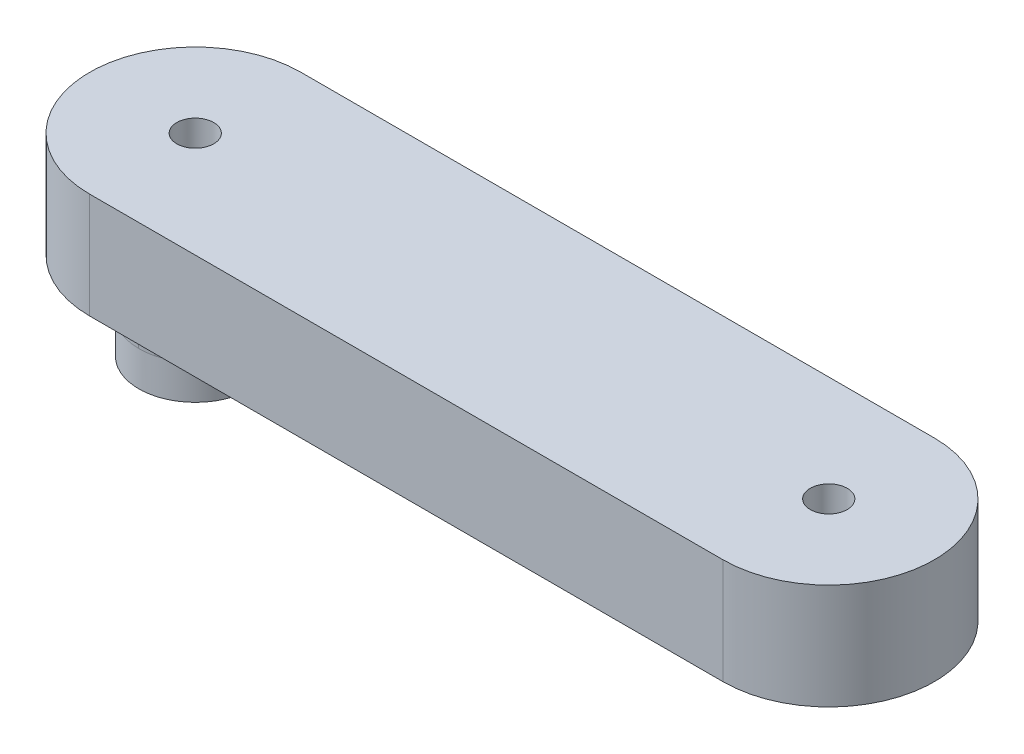
from build123d import *

# Parameters (mm, degrees)
BOSS_EXTRUDE1_DEPTH = 10
CUT_EXTRUDE1_REACH  = 44.426
SKETCH2_R           = 1.75
SKETCH5_R           = 5.35
BOSS_EXTRUDE3_DEPTH = 8.3
FILLET1_R           = 5
CUT_EXTRUDE2_REACH  = 47.11
SKETCH6_R           = 1.75


with BuildPart() as part:
    # Sketch1 → Boss-Extrude1 (new body)
    with BuildSketch(Plane(origin=(0, 0, 0), x_dir=(1, 0, 0), z_dir=(0, 1, 0))):
        with BuildLine():
            Line((-30, 10), (30, 10))
            ThreePointArc((30, 10), (40, 0), (30, -10))
            Line((30, -10), (-30, -10))
            ThreePointArc((-30, -10), (-40, 0), (-30, 10))
        make_face()
    extrude(amount=BOSS_EXTRUDE1_DEPTH)

    # Sketch2 → Cut-Extrude1 (cut, up to next)
    with BuildSketch(Plane(origin=(0, 10, 0), x_dir=(1, 0, 0), z_dir=(0, 1, 0)), mode=Mode.PRIVATE) as cut_extrude1_sk1:
        with Locations((30, 0)):
            Circle(SKETCH2_R)
    cut_extrude1_tool1 = extrude(cut_extrude1_sk1.sketch, amount=-CUT_EXTRUDE1_REACH, mode=Mode.PRIVATE) & part.part
    add(cut_extrude1_tool1.solids().sort_by_distance((30, 10, 0))[0], mode=Mode.SUBTRACT)

    # Sketch5 → Boss-Extrude3 (add)
    with BuildSketch(Plane.XZ):
        with Locations((-30, 0)):
            Circle(SKETCH5_R)
    extrude(amount=BOSS_EXTRUDE3_DEPTH)

    # Fillet1
    fillet1_edges = [part.edges().sort_by_distance(p)[0] for p in [
        (-35.35, 0, 0),
    ]]
    fillet(fillet1_edges, radius=FILLET1_R)

    # Sketch6 → Cut-Extrude2 (cut, up to next)
    with BuildSketch(Plane(origin=(0, -8.3, 0), x_dir=(-1, 0, 0), z_dir=(0, -1, 0)), mode=Mode.PRIVATE) as cut_extrude2_sk1:
        with Locations((30, 0)):
            Circle(SKETCH6_R)
    cut_extrude2_tool1 = extrude(cut_extrude2_sk1.sketch, amount=-CUT_EXTRUDE2_REACH, mode=Mode.PRIVATE) & part.part
    add(cut_extrude2_tool1.solids().sort_by_distance((-30, -8.3, 0))[0], mode=Mode.SUBTRACT)


solid = part.part
